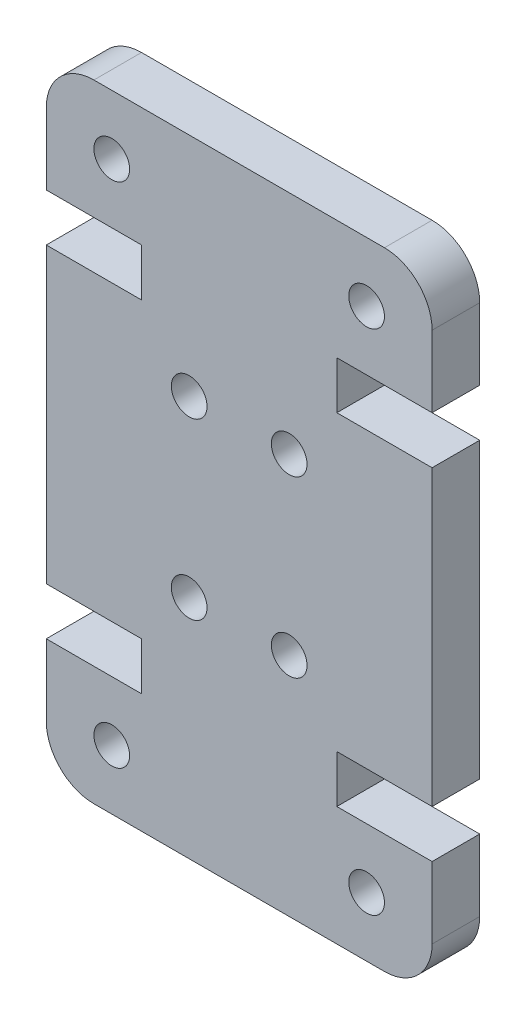
from build123d import *

# Parameters (mm, degrees)
SKETCH2_R           = 0.75
BOSS_EXTRUDE1_DEPTH = 2


with BuildPart() as part:
    # Sketch2 → Boss-Extrude1 (new body)
    with BuildSketch(Plane.XY):
        with BuildLine():
            Line((0, 19.32), (0, 7))
            Line((0, 7), (4, 7))
            Line((4, 7), (4, 5))
            Line((4, 5), (0, 5))
            Line((0, 5), (0, 2))
            ThreePointArc((0, 2), (0.585786438, 0.585786438), (2, 0))
            Line((2, 0), (14.2, 0))
            ThreePointArc((14.2, 0), (15.614213562, 0.585786438), (16.2, 2))
            Line((16.2, 2), (16.2, 5))
            Line((16.2, 5), (12.2, 5))
            Line((12.2, 5), (12.2, 7))
            Line((12.2, 7), (16.2, 7))
            Line((16.2, 7), (16.2, 19.32))
            Line((16.2, 19.32), (12.2, 19.32))
            Line((12.2, 19.32), (12.2, 21.32))
            Line((12.2, 21.32), (16.2, 21.32))
            Line((16.2, 21.32), (16.2, 24.32))
            ThreePointArc((16.2, 24.32), (15.614213562, 25.734213562), (14.2, 26.32))
            Line((14.2, 26.32), (2, 26.32))
            ThreePointArc((2, 26.32), (0.585786438, 25.734213562), (0, 24.32))
            Line((0, 24.32), (0, 21.32))
            Line((0, 21.32), (4, 21.32))
            Line((4, 21.32), (4, 19.32))
            Line((4, 19.32), (0, 19.32))
        make_face()
        with Locations((10.2, 16.82)):
            Circle(SKETCH2_R, mode=Mode.SUBTRACT)
        with Locations((6, 16.82)):
            Circle(SKETCH2_R, mode=Mode.SUBTRACT)
        with Locations((10.2, 9.5)):
            Circle(SKETCH2_R, mode=Mode.SUBTRACT)
        with Locations((6, 9.5)):
            Circle(SKETCH2_R, mode=Mode.SUBTRACT)
        with Locations((13.45, 2.5)):
            Circle(SKETCH2_R, mode=Mode.SUBTRACT)
        with Locations((2.75, 2.5)):
            Circle(SKETCH2_R, mode=Mode.SUBTRACT)
        with Locations((13.45, 23.82)):
            Circle(SKETCH2_R, mode=Mode.SUBTRACT)
        with Locations((2.75, 23.82)):
            Circle(SKETCH2_R, mode=Mode.SUBTRACT)
    extrude(amount=BOSS_EXTRUDE1_DEPTH)


solid = part.part
